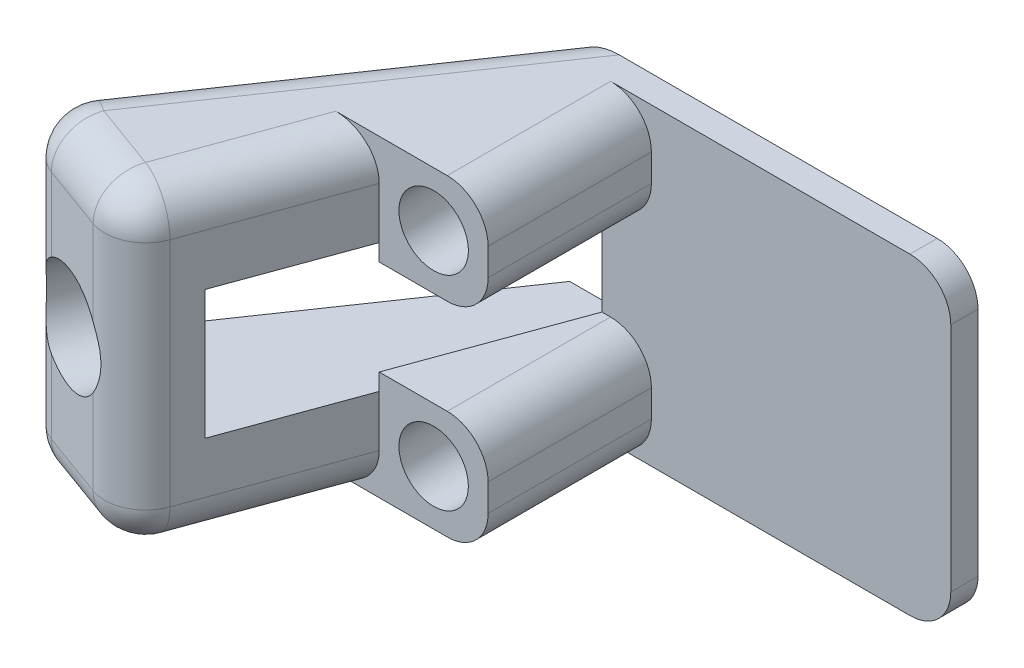
from build123d import *

# Parameters (mm, degrees)
CROQUIS3_W              = 30
CROQUIS3_H              = 23
CROQUIS3_R              = 2.55
SALIENTE_EXTRUIR2_DEPTH = 2
CROQUIS5_W              = 8
CROQUIS5_H              = 8
CROQUIS5_R              = 2.55
SALIENTE_EXTRUIR3_DEPTH = 12
SALIENTE_EXTRUIR4_DEPTH = 23
CROQUIS7_R              = 3.75
CORTAR_EXTRUIR1_DEPTH   = 15
CORTAR_EXTRUIR7_START   = -3
CORTAR_EXTRUIR7_DEPTH   = 20
CORTAR_EXTRUIR8_START   = 2
CROQUIS14_W             = 8.13201816
CROQUIS14_H             = 9.468544415
CORTAR_EXTRUIR8_DEPTH   = 25
CROQUIS15_W             = 24.194573687
CROQUIS15_H             = 9.468544415
CORTAR_EXTRUIR9_DEPTH   = 1.933991
REDONDEO1_R             = 3


with BuildPart() as part:
    # Croquis3 → Saliente-Extruir2 (new body)
    with BuildSketch(Plane.XY):
        with Locations((-48.169014085, 19.436619718)):
            Rectangle(CROQUIS3_W, CROQUIS3_H)
        with Locations((-59.169014085, 26.936619718)):
            Circle(CROQUIS3_R, mode=Mode.SUBTRACT)
        with Locations(Location((-59.169014085, 11.936619718, 0), (0, 0, 180))):
            Circle(CROQUIS3_R, mode=Mode.SUBTRACT)
    extrude(amount=SALIENTE_EXTRUIR2_DEPTH)

    # Croquis5 → Saliente-Extruir3 (add)
    # profile 1 of 2: a face of its own
    with BuildSketch(Plane.XY.offset(2)):
        with Locations((-59.169014085, 11.936619718)):
            Rectangle(CROQUIS5_W, CROQUIS5_H)
        with Locations(Location((-59.169014085, 11.936619718, 0), (0, 0, 180))):
            Circle(CROQUIS5_R, mode=Mode.SUBTRACT)
    # profile 2 of 2: a face of its own
    with BuildSketch(Plane.XY.offset(2)):
        with Locations((-59.169014085, 26.936619718)):
            Rectangle(CROQUIS5_W, CROQUIS5_H)
        with Locations(Location((-59.169014085, 26.936619718, 0), (0, 0, 180))):
            Circle(CROQUIS5_R, mode=Mode.SUBTRACT)
    extrude(amount=SALIENTE_EXTRUIR3_DEPTH)

    # Croquis6 → Saliente-Extruir4 (add)
    with BuildSketch(Plane(origin=(0, 30.936619718, 0), x_dir=(1, 0, 0), z_dir=(0, 1, 0))):
        Polygon((-63.169014085, -14), (-68.299316234, -28.095389312), (-79.575627684, -23.991147592), (-63.169014085, 0), align=None)
    extrude(amount=-SALIENTE_EXTRUIR4_DEPTH)

    # Croquis7 → Cortar-Extruir1 (cut)
    with BuildSketch(Plane(origin=(-17.019186352, 0, 46.759830198), x_dir=(0.9396926207859082, 0, 0.3420201433256694), z_dir=(-0.3420201433256694, 0, 0.9396926207859083))):
        with Locations((-60.571174391, 19.436619718)):
            Circle(CROQUIS7_R)
    extrude(amount=-CORTAR_EXTRUIR1_DEPTH, mode=Mode.SUBTRACT)

    # Croquis13 → Cortar-Extruir7 (cut)
    with BuildSketch(Plane(origin=(-17.019186352, 0, 46.759830198), x_dir=(0.9396926207859082, 0, 0.3420201433256694), z_dir=(-0.3420201433256694, 0, 0.9396926207859083)).offset(CORTAR_EXTRUIR7_START)):
        Polygon((-60.571174391, 14.702347511), (-56.471174391, 17.069483615), (-56.471174391, 21.803755822), (-60.571174391, 24.170891926), (-64.671174391, 21.803755822), (-64.671174391, 17.069483615), align=None)
    extrude(amount=-CORTAR_EXTRUIR7_DEPTH, mode=Mode.SUBTRACT)

    # Croquis14 → Cortar-Extruir8 (cut)
    with BuildSketch(Plane(origin=(-15.993125922, 0, 43.940752336), x_dir=(-0.9396926207859081, 0, -0.34202014332566977), z_dir=(0.3420201433256697, 0, -0.939692620785908)).offset(CORTAR_EXTRUIR8_START)):
        with Locations((60.571174391, 19.436619719)):
            Rectangle(CROQUIS14_W, CROQUIS14_H)
    extrude(amount=CORTAR_EXTRUIR8_DEPTH, mode=Mode.SUBTRACT)

    # Croquis15 → Cortar-Extruir9 (cut)
    with BuildSketch(Plane(origin=(-53.097486879, 0, -19.325904738), x_dir=(-0.34202014332566977, 0, 0.9396926207859081), z_dir=(-0.939692620785908, 0, -0.3420201433256697))):
        with Locations((32.663485099, 19.436619719)):
            Rectangle(CROQUIS15_W, CROQUIS15_H)
    extrude(amount=-CORTAR_EXTRUIR9_DEPTH, mode=Mode.SUBTRACT)

    # Redondeo1
    # the kernel refuses this fillet: 3 mm, written as the material it takes off along each edge
    with BuildSketch(Plane(origin=(-70.092333667, 10.936619718, 24.250251019), x_dir=(0.9396926207859081, 0, 0.34202014332566966), z_dir=(0, -1, 0))) as redondeo1_piece_1_section:
        Polygon((0, 0), (REDONDEO1_R * 1.02, 0), (REDONDEO1_R * 1.02, REDONDEO1_R * 1.02), (0, REDONDEO1_R * 1.02), align=None)
    redondeo1_piece_1 = extrude(amount=REDONDEO1_R * 1.02, mode=Mode.PRIVATE)
    redondeo1_piece_1 = redondeo1_piece_1 - Plane(origin=(-70.092333667, 10.936619718, 24.250251019), x_dir=(-0.4226182617406987, 0, -0.9063077870366504), z_dir=(0, -1, 0)) * Sphere(REDONDEO1_R, mode=Mode.PRIVATE)
    add(redondeo1_piece_1, mode=Mode.SUBTRACT)
    with BuildSketch(Plane(origin=(-74.917413437, 10.936619718, 22.494065605), x_dir=(-0.3420201433256695, 0, 0.9396926207859081), z_dir=(0, -1, 0))) as redondeo1_piece_2_section:
        Polygon((0, 0), (REDONDEO1_R * 1.02, 0), (REDONDEO1_R * 1.02, REDONDEO1_R * 1.31418750187), (-REDONDEO1_R * 0.253089576506, REDONDEO1_R * 0.988102052555), align=None)
    redondeo1_piece_2 = extrude(amount=REDONDEO1_R * 1.02, mode=Mode.PRIVATE)
    redondeo1_piece_2 = redondeo1_piece_2 - Plane(origin=(-74.917413437, 10.936619718, 22.494065605), x_dir=(0.9520405381935744, 0, -0.30597191641732324), z_dir=(0, -1, 0)) * Sphere(REDONDEO1_R, mode=Mode.PRIVATE)
    add(redondeo1_piece_2, mode=Mode.SUBTRACT)
    with BuildSketch(Plane(origin=(-70.092333667, 27.936619718, 24.250251019), x_dir=(0.9396926207859081, 0, 0.34202014332566966), z_dir=(0, 1, 0))) as redondeo1_piece_3_section:
        Polygon((0, 0), (REDONDEO1_R * 1.02, 0), (REDONDEO1_R * 1.02, -REDONDEO1_R * 1.02), (0, -REDONDEO1_R * 1.02), align=None)
    redondeo1_piece_3 = extrude(amount=REDONDEO1_R * 1.02, mode=Mode.PRIVATE)
    redondeo1_piece_3 = redondeo1_piece_3 - Plane(origin=(-70.092333667, 27.936619718, 24.250251019), x_dir=(-0.4226182617406987, 0, -0.9063077870366504), z_dir=(0, 1, 0)) * Sphere(REDONDEO1_R, mode=Mode.PRIVATE)
    add(redondeo1_piece_3, mode=Mode.SUBTRACT)
    with BuildSketch(Plane(origin=(-74.917413437, 27.936619718, 22.494065605), x_dir=(-0.3420201433256695, 0, 0.9396926207859081), z_dir=(0, 1, 0))) as redondeo1_piece_4_section:
        Polygon((0, 0), (REDONDEO1_R * 1.02, 0), (REDONDEO1_R * 1.02, -REDONDEO1_R * 1.31418750187), (-REDONDEO1_R * 0.253089576506, -REDONDEO1_R * 0.988102052555), align=None)
    redondeo1_piece_4 = extrude(amount=REDONDEO1_R * 1.02, mode=Mode.PRIVATE)
    redondeo1_piece_4 = redondeo1_piece_4 - Plane(origin=(-74.917413437, 27.936619718, 22.494065605), x_dir=(0.9520405381935744, 0, -0.30597191641732324), z_dir=(0, 1, 0)) * Sphere(REDONDEO1_R, mode=Mode.PRIVATE)
    add(redondeo1_piece_4, mode=Mode.SUBTRACT)
    with BuildSketch(Plane(origin=(-55.169014085, 7.936619718, 2), x_dir=(0, 1, 0), z_dir=(0, 0, 1)), Plane(origin=(-55.169014085, 15.936619718, 2), x_dir=(-1, 0, 0), z_dir=(0, 0, 1)), Plane(origin=(-55.169014085, 30.936619718, 2), x_dir=(-1, 0, 0), z_dir=(0, 0, 1))) as redondeo1_piece_5:
        with BuildLine():
            CenterArc((REDONDEO1_R, REDONDEO1_R), REDONDEO1_R, 180, 90)
            Line((0, REDONDEO1_R), (0, 0))
            Line((0, 0), (REDONDEO1_R, 0))
        make_face()
    extrude(amount=19.5, mode=Mode.SUBTRACT)
    with BuildSketch(Plane(origin=(-55.169014085, 22.936619718, 2), x_dir=(-1, 0, 0), z_dir=(0, 0, 1))) as redondeo1_piece_6:
        with BuildLine():
            CenterArc((REDONDEO1_R, -REDONDEO1_R), REDONDEO1_R, 90, 90)
            Line((0, -REDONDEO1_R), (0, 0))
            Line((0, 0), (REDONDEO1_R, 0))
        make_face()
    extrude(amount=19.5, mode=Mode.SUBTRACT)
    with BuildSketch(Plane(origin=(-60.60386301, 7.936619718, 6.952305344), x_dir=(0, 1, 0), z_dir=(-0.34202014332566966, 0, 0.9396926207859081))) as redondeo1_piece_7_section:
        with BuildLine():
            CenterArc((REDONDEO1_R, REDONDEO1_R), REDONDEO1_R, 180, 90)
            Line((0, REDONDEO1_R), (0, 0))
            Line((0, 0), (REDONDEO1_R, 0))
        make_face()
    redondeo1_piece_7 = extrude(amount=19.5, mode=Mode.PRIVATE)
    redondeo1_piece_7 = split(redondeo1_piece_7, bisect_by=Plane(origin=(-65.882719938, 8.612486754, 14), z_dir=(0, 0, 1)), keep=Keep.TOP, mode=Mode.PRIVATE)
    add(redondeo1_piece_7, mode=Mode.SUBTRACT)
    with BuildSketch(Plane(origin=(-71.118394097, 7.936619718, 27.069328882), x_dir=(0.3420201433256695, 0, -0.9396926207859081), z_dir=(-0.9396926207859081, 0, -0.3420201433256695))) as redondeo1_piece_8:
        with BuildLine():
            CenterArc((REDONDEO1_R, -REDONDEO1_R), REDONDEO1_R, 90, 90)
            Line((0, -REDONDEO1_R), (0, 0))
            Line((0, 0), (REDONDEO1_R, 0))
        make_face()
    extrude(amount=5.134742642, mode=Mode.SUBTRACT)
    with BuildSketch(Plane(origin=(-68.299316234, 27.936619718, 28.095389312), x_dir=(0.34202014332566905, 0, -0.9396926207859082), z_dir=(0, -1, 0)), Plane(origin=(-33.169014085, 7.936619718, -7.5), x_dir=(-1, 0, 0), z_dir=(0, 0, 1))) as redondeo1_piece_9:
        with BuildLine():
            CenterArc((REDONDEO1_R, -REDONDEO1_R), REDONDEO1_R, 90, 90)
            Line((0, -REDONDEO1_R), (0, 0))
            Line((0, 0), (REDONDEO1_R, 0))
        make_face()
    extrude(amount=17, mode=Mode.SUBTRACT)
    with BuildSketch(Plane(origin=(-77.393738361, 7.936619718, 20.800603214), x_dir=(0.8254416413123481, 0, 0.5644874638001954), z_dir=(0.5644874638001954, 0, -0.8254416413123482))) as redondeo1_piece_10:
        with BuildLine():
            CenterArc((REDONDEO1_R, -REDONDEO1_R), REDONDEO1_R, 90, 90)
            Line((0, -REDONDEO1_R), (0, 0))
            Line((0, 0), (REDONDEO1_R, 0))
        make_face()
    extrude(amount=32.699362587, mode=Mode.SUBTRACT)
    with BuildSketch(Plane(origin=(-79.575627684, 27.936619718, 23.991147592), x_dir=(0.9396926207859081, 0, 0.3420201433256696), z_dir=(0, -1, 0))) as redondeo1_piece_11:
        with BuildLine():
            CenterArc((REDONDEO1_R * 1.28841911948, -REDONDEO1_R), REDONDEO1_R, 90, 104.366707449)
            Line((REDONDEO1_R * 0.319691616972, -REDONDEO1_R * 1.24812703579), (0, 0))
            Line((0, 0), (REDONDEO1_R * 1.28841911948, 0))
        make_face()
    extrude(amount=17, mode=Mode.SUBTRACT)
    with BuildSketch(Plane(origin=(-77.393738361, 30.936619718, 20.800603214), x_dir=(0.8254416413123481, 0, 0.5644874638001954), z_dir=(0.5644874638001954, 0, -0.8254416413123482))) as redondeo1_piece_12:
        with BuildLine():
            CenterArc((REDONDEO1_R, REDONDEO1_R), REDONDEO1_R, 180, 90)
            Line((0, REDONDEO1_R), (0, 0))
            Line((0, 0), (REDONDEO1_R, 0))
        make_face()
    extrude(amount=32.699362587, mode=Mode.SUBTRACT)
    with BuildSketch(Plane(origin=(-71.118394097, 30.936619718, 27.069328882), x_dir=(0.3420201433256695, 0, -0.9396926207859081), z_dir=(-0.9396926207859081, 0, -0.3420201433256695))) as redondeo1_piece_13:
        with BuildLine():
            CenterArc((REDONDEO1_R, REDONDEO1_R), REDONDEO1_R, 180, 90)
            Line((0, REDONDEO1_R), (0, 0))
            Line((0, 0), (REDONDEO1_R, 0))
        make_face()
    extrude(amount=5.134742642, mode=Mode.SUBTRACT)
    with BuildSketch(Plane(origin=(-60.60386301, 30.936619718, 6.952305344), x_dir=(-0.9396926207859081, 0, -0.3420201433256697), z_dir=(-0.34202014332566966, 0, 0.9396926207859081))) as redondeo1_piece_14_section:
        with BuildLine():
            CenterArc((REDONDEO1_R, REDONDEO1_R), REDONDEO1_R, 180, 90)
            Line((0, REDONDEO1_R), (0, 0))
            Line((0, 0), (REDONDEO1_R, 0))
        make_face()
    redondeo1_piece_14 = extrude(amount=19.5, mode=Mode.PRIVATE)
    redondeo1_piece_14 = split(redondeo1_piece_14, bisect_by=Plane(origin=(-65.882719938, 30.260752682, 14), z_dir=(0, 0, 1)), keep=Keep.TOP, mode=Mode.PRIVATE)
    add(redondeo1_piece_14, mode=Mode.SUBTRACT)
    with BuildSketch(Plane(origin=(-33.169014085, 30.936619718, -7.5), x_dir=(-1, 0, 0), z_dir=(0, 0, 1))) as redondeo1_piece_15:
        with BuildLine():
            CenterArc((REDONDEO1_R, REDONDEO1_R), REDONDEO1_R, 180, 90)
            Line((0, REDONDEO1_R), (0, 0))
            Line((0, 0), (REDONDEO1_R, 0))
        make_face()
    extrude(amount=17, mode=Mode.SUBTRACT)


solid = part.part
